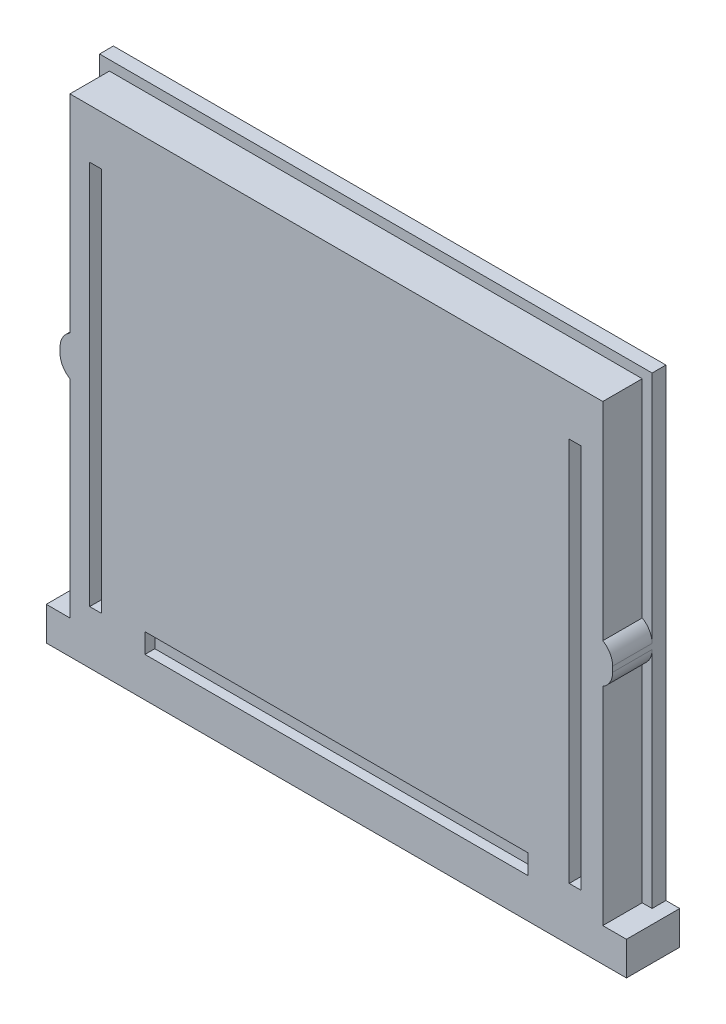
from build123d import *

# Parameters (mm, degrees)
SKIZZE1_W                       = 28
SKIZZE1_H                       = 23
AUFSATZ_LINEAR_AUSTRAGEN1_DEPTH = 0.7
SKIZZE3_W                       = 27
SKIZZE3_H                       = 22.5
AUFSATZ_LINEAR_AUSTRAGEN2_DEPTH = 2
AUFSATZ_LINEAR_AUSTRAGEN4_DEPTH = 1.7
SKIZZE6_W                       = 0.6
SKIZZE6_H                       = 22
SCHNITT_LINEAR_AUSTRAGEN1_DEPTH = 10
SKIZZE7_W                       = 2
SKIZZE7_H                       = 2
AUFSATZ_LINEAR_AUSTRAGEN5_DEPTH = 0.5
SKIZZE8_W                       = 2
SKIZZE8_H                       = 2
AUFSATZ_LINEAR_AUSTRAGEN6_DEPTH = 0.5
VERRUNDUNG1_R                   = 1
VERRUNDUNG2_R                   = 1
SKIZZE9_W                       = 27
SKIZZE9_H                       = 2.5
AUFSATZ_LINEAR_AUSTRAGEN7_DEPTH = 2.7
SKIZZE10_W                      = 28
SKIZZE10_H                      = 0.7
AUFSATZ_LINEAR_AUSTRAGEN8_DEPTH = 0.5
SKIZZE11_W                      = 19.4
SKIZZE11_H                      = 1
SCHNITT_LINEAR_AUSTRAGEN2_DEPTH = 0.5


with BuildPart() as part:
    # Skizze1 → Aufsatz-Linear austragen1 (new body)
    with BuildSketch(Plane.XY):
        with Locations((19.366132402, 11.5)):
            Rectangle(SKIZZE1_W, SKIZZE1_H)
    extrude(amount=AUFSATZ_LINEAR_AUSTRAGEN1_DEPTH)

    # Skizze3 → Aufsatz-Linear austragen2 (add)
    with BuildSketch(Plane.XY.offset(0.7)):
        with Locations((19.366132402, 11.25)):
            Rectangle(SKIZZE3_W, SKIZZE3_H)
    extrude(amount=AUFSATZ_LINEAR_AUSTRAGEN2_DEPTH)

    # Skizze5 → Aufsatz-Linear austragen4 (add)
    with BuildSketch(Plane.XZ):
        Polygon((5.866132402, 2.7), (32.866132402, 2.7), (34.066132402, 2.7), (34.066132402, 0), (33.366132402, 0), (5.366132402, 0), (4.666132402, 0), (4.666132402, 2.7), align=None)
    extrude(amount=AUFSATZ_LINEAR_AUSTRAGEN4_DEPTH)

    # Skizze6 → Schnitt-Linear austragen1 (cut)
    with BuildSketch(Plane(origin=(0, 0, 0), x_dir=(-1, 0, 0), z_dir=(0, 0, -1))):
        with Locations((-31.466132402, 12)):
            Rectangle(SKIZZE6_W, SKIZZE6_H)
        with Locations((-7.166132402, 12)):
            Rectangle(SKIZZE6_W, SKIZZE6_H)
    extrude(amount=-SCHNITT_LINEAR_AUSTRAGEN1_DEPTH, mode=Mode.SUBTRACT)

    # Skizze7 → Aufsatz-Linear austragen5 (add)
    with BuildSketch(Plane(origin=(32.866132402, 0, 0), x_dir=(0, 0, -1), z_dir=(1, 0, 0))):
        with Locations((-1.7, 11.5)):
            Rectangle(SKIZZE7_W, SKIZZE7_H)
    extrude(amount=AUFSATZ_LINEAR_AUSTRAGEN5_DEPTH)

    # Skizze8 → Aufsatz-Linear austragen6 (add)
    with BuildSketch(Plane.ZY.offset(-5.866132402)):
        with Locations((1.7, 11.5)):
            Rectangle(SKIZZE8_W, SKIZZE8_H)
    extrude(amount=AUFSATZ_LINEAR_AUSTRAGEN6_DEPTH)

    # Verrundung1
    # the kernel refuses this fillet: 1 mm, written as the material it takes off along each edge
    with BuildSketch(Plane(origin=(33.366132402, 10.5, 0.7), x_dir=(-1, 0, 0), z_dir=(0, 0, 1))) as verrundung1_piece_1:
        with BuildLine():
            CenterArc((1, -0.866025404), VERRUNDUNG1_R, 120, 60)
            Line((0, -0.866025404), (0, 0))
            Line((0, 0), (0.5, 0))
        make_face()
    extrude(amount=4.165063509, mode=Mode.SUBTRACT)
    with BuildSketch(Plane(origin=(33.366132402, 12.5, 4.865063509), x_dir=(0, -1, 0), z_dir=(0, 0, -1))) as verrundung1_piece_2:
        with BuildLine():
            CenterArc((0.866025404, 1), VERRUNDUNG1_R, 210, 60)
            Line((0, 0.5), (0, 0))
            Line((0, 0), (0.866025404, 0))
        make_face()
    extrude(amount=4.165063509, mode=Mode.SUBTRACT)

    # Verrundung2
    # the kernel refuses this fillet: 1 mm, written as the material it takes off along each edge
    with BuildSketch(Plane(origin=(5.366132402, 12.5, 0.7), x_dir=(1, 0, 0), z_dir=(0, 0, 1))) as verrundung2_piece_1:
        with BuildLine():
            CenterArc((1, -0.866025404), VERRUNDUNG2_R, 120, 60)
            Line((0, -0.866025404), (0, 0))
            Line((0, 0), (0.5, 0))
        make_face()
    extrude(amount=4.165063509, mode=Mode.SUBTRACT)
    with BuildSketch(Plane(origin=(5.366132402, 10.5, 4.865063509), x_dir=(0, 1, 0), z_dir=(0, 0, -1))) as verrundung2_piece_2:
        with BuildLine():
            CenterArc((0.866025404, 1), VERRUNDUNG2_R, 210, 60)
            Line((0, 0.5), (0, 0))
            Line((0, 0), (0.866025404, 0))
        make_face()
    extrude(amount=4.165063509, mode=Mode.SUBTRACT)

    # Skizze9 → Aufsatz-Linear austragen7 (add)
    with BuildSketch(Plane.XY.offset(2.7)):
        with Locations((19.366132402, 21.75)):
            Rectangle(SKIZZE9_W, SKIZZE9_H)
    extrude(amount=-AUFSATZ_LINEAR_AUSTRAGEN7_DEPTH)

    # Skizze10 → Aufsatz-Linear austragen8 (add)
    with BuildSketch(Plane(origin=(0, 23, 0), x_dir=(1, 0, 0), z_dir=(0, 1, 0))):
        with Locations((19.366132402, -0.35)):
            Rectangle(SKIZZE10_W, SKIZZE10_H)
    extrude(amount=AUFSATZ_LINEAR_AUSTRAGEN8_DEPTH)

    # Skizze11 → Schnitt-Linear austragen2 (cut)
    with BuildSketch(Plane.XY.offset(2.7)):
        with Locations((19.366132402, 0.8)):
            Rectangle(SKIZZE11_W, SKIZZE11_H)
    extrude(amount=-SCHNITT_LINEAR_AUSTRAGEN2_DEPTH, mode=Mode.SUBTRACT)


solid = part.part
